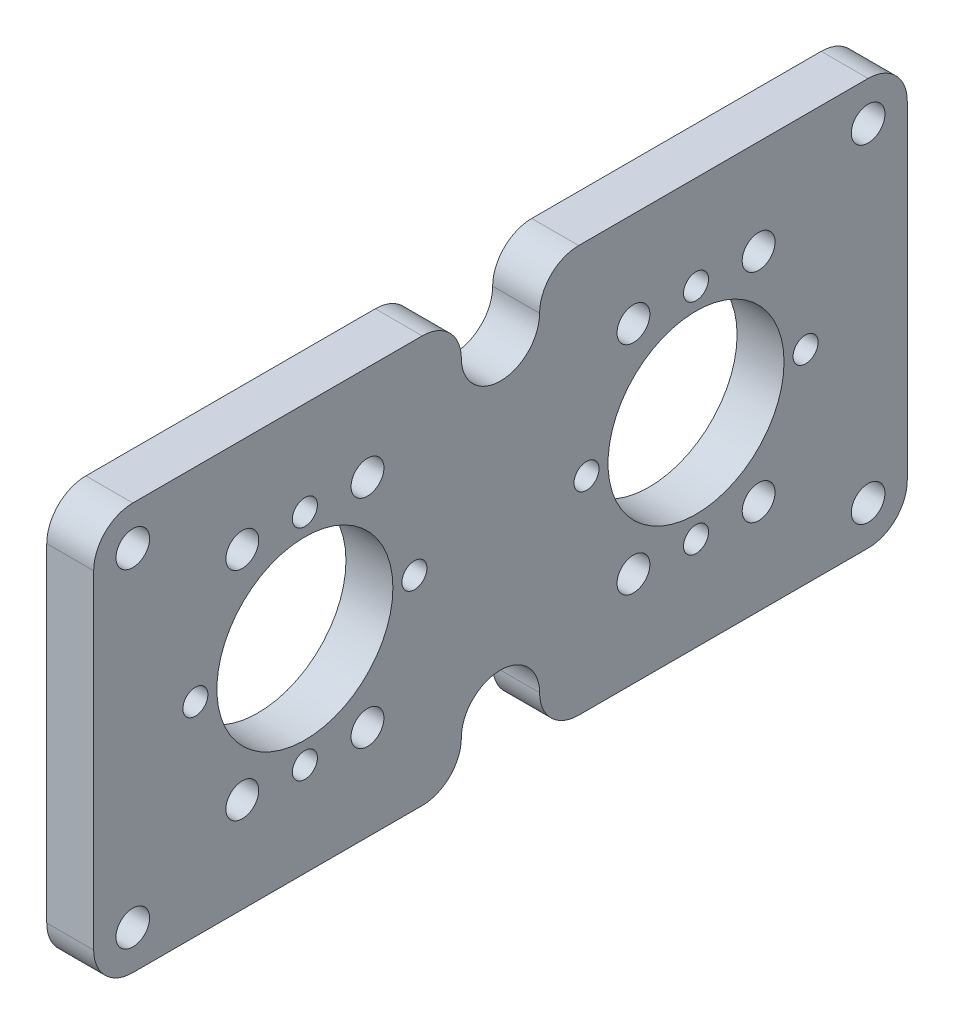
from build123d import *

# Parameters (mm, degrees)
SKETCH_1_W          = 104
SKETCH_1_H          = 52
SKETCH_1_R          = 11.25
EXTRUDE_1_DEPTH     = 6
SKETCH_2_R          = 2.15
SKETCH_2_R_2        = 5
CUT_EXTRUDE_1_DEPTH = 10
FILLET_2_R          = 5
SKETCH_3_R          = 1.6
SKETCH_3_R_2        = 2.1
CUT_EXTRUDE_2_DEPTH = 10
SKETCH1_R           = 4
CUT_EXTRUDE1_DEPTH  = 2


with BuildPart() as part:
    # 草图1 → 凸台-拉伸1 (new body)
    with BuildSketch(Plane(origin=(0, 0, 0), x_dir=(0, 0, -1), z_dir=(1, 0, 0))):
        with Locations((245.135135135, 41.033128111)):
            Rectangle(SKETCH_1_W, SKETCH_1_H)
        with Locations((220.135135135, 41.033128111)):
            Circle(SKETCH_1_R, mode=Mode.SUBTRACT)
        with Locations((270.135135135, 41.033128111)):
            Circle(SKETCH_1_R, mode=Mode.SUBTRACT)
    extrude(amount=EXTRUDE_1_DEPTH)

    # 草图2 → 切除-拉伸1 (cut)
    # profile 1 of 12: a face of its own
    with BuildSketch(Plane(origin=(6, 0, 0), x_dir=(0, 0, -1), z_dir=(1, 0, 0))):
        with Locations((198.135135135, 62.033128111)):
            Circle(SKETCH_2_R)
    # profile 2 of 12: a face of its own
    with BuildSketch(Plane(origin=(6, 0, 0), x_dir=(0, 0, -1), z_dir=(1, 0, 0))):
        with Locations((198.135135135, 20.033128111)):
            Circle(SKETCH_2_R)
    # profile 3 of 12: a face of its own
    with BuildSketch(Plane(origin=(6, 0, 0), x_dir=(0, 0, -1), z_dir=(1, 0, 0))):
        with Locations((245.135135135, 20.033128111)):
            Circle(SKETCH_2_R_2)
        with Locations((245.135135135, 20.033128111)):
            Circle(SKETCH_2_R, mode=Mode.SUBTRACT)
    # profile 4 of 12: a face of its own
    with BuildSketch(Plane(origin=(6, 0, 0), x_dir=(0, 0, -1), z_dir=(1, 0, 0))):
        with BuildLine():
            Line((245.13513516, 15.033128111), (250.135135135, 15.033128111))
            Line((250.135135135, 15.033128111), (250.135135135, 20.033128111))
            ThreePointArc((250.135135135, 20.033128111), (248.67066905, 16.497594214), (245.13513516, 15.033128111))
        make_face()
    # profile 5 of 12: a face of its own
    with BuildSketch(Plane(origin=(6, 0, 0), x_dir=(0, 0, -1), z_dir=(1, 0, 0))):
        with BuildLine():
            Line((240.135135135, 15.033128111), (245.13513516, 15.033128111))
            ThreePointArc((245.13513516, 15.033128111), (241.599601238, 16.497594196), (240.135135135, 20.033128111))
            Line((240.135135135, 20.033128111), (240.135135135, 15.033128111))
        make_face()
    # profile 6 of 12: a face of its own
    with BuildSketch(Plane(origin=(6, 0, 0), x_dir=(0, 0, -1), z_dir=(1, 0, 0))):
        with Locations((245.135135135, 20.033128111)):
            Circle(SKETCH_2_R)
    # profile 7 of 12: a face of its own
    with BuildSketch(Plane(origin=(6, 0, 0), x_dir=(0, 0, -1), z_dir=(1, 0, 0))):
        with Locations((245.135135135, 62.033128111)):
            Circle(SKETCH_2_R_2)
        with Locations((245.135135135, 62.033128111)):
            Circle(SKETCH_2_R, mode=Mode.SUBTRACT)
    # profile 8 of 12: a face of its own
    with BuildSketch(Plane(origin=(6, 0, 0), x_dir=(0, 0, -1), z_dir=(1, 0, 0))):
        with Locations((245.135135135, 62.033128111)):
            Circle(SKETCH_2_R)
    # profile 9 of 12: a face of its own
    with BuildSketch(Plane(origin=(6, 0, 0), x_dir=(0, 0, -1), z_dir=(1, 0, 0))):
        with BuildLine():
            ThreePointArc((245.135135095, 67.033128111), (248.670669027, 65.568662031), (250.135135135, 62.033128111))
            Line((250.135135135, 62.033128111), (250.135135135, 67.033128111))
            Line((250.135135135, 67.033128111), (245.135135095, 67.033128111))
        make_face()
    # profile 10 of 12: a face of its own
    with BuildSketch(Plane(origin=(6, 0, 0), x_dir=(0, 0, -1), z_dir=(1, 0, 0))):
        with BuildLine():
            Line((240.135135135, 67.033128111), (240.135135135, 62.033128111))
            ThreePointArc((240.135135135, 62.033128111), (241.599601215, 65.568662003), (245.135135095, 67.033128111))
            Line((245.135135095, 67.033128111), (240.135135135, 67.033128111))
        make_face()
    # profile 11 of 12: a face of its own
    with BuildSketch(Plane(origin=(6, 0, 0), x_dir=(0, 0, -1), z_dir=(1, 0, 0))):
        with Locations((292.135135135, 62.033128111)):
            Circle(SKETCH_2_R)
    # profile 12 of 12: a face of its own
    with BuildSketch(Plane(origin=(6, 0, 0), x_dir=(0, 0, -1), z_dir=(1, 0, 0))):
        with Locations((292.135135135, 20.033128111)):
            Circle(SKETCH_2_R)
    extrude(amount=-CUT_EXTRUDE_1_DEPTH, mode=Mode.SUBTRACT)

    # 圆角2
    fillet_2_edges = [part.edges().sort_by_distance(p)[0] for p in [
        (3, 15.033128111, -240.135135135),
        (3, 15.033128111, -193.135135135),
        (3, 67.033128111, -240.135135135),
        (3, 67.033128111, -250.135135135),
        (3, 67.033128111, -297.135135135),
        (3, 15.033128111, -297.135135135),
        (3, 15.033128111, -250.135135135),
        (3, 67.033128111, -193.135135135),
    ]]
    fillet(fillet_2_edges, radius=FILLET_2_R - 0.0001)  # a hair under: the kernel refuses the full size

    # 草图3 → 切除-拉伸2 (cut)
    with BuildSketch(Plane(origin=(6, 0, 0), x_dir=(0, 0, -1), z_dir=(1, 0, 0))):
        with Locations((220.135135135, 55.033128111)):
            Circle(SKETCH_3_R)
        with Locations((228.135135135, 54.889534571)):
            Circle(SKETCH_3_R_2)
        with Locations((228.135135135, 27.17672165)):
            Circle(SKETCH_3_R_2)
        with Locations((212.135135135, 27.17672165)):
            Circle(SKETCH_3_R_2)
        with Locations((212.135135135, 54.889534571)):
            Circle(SKETCH_3_R_2)
        with Locations((234.135135135, 41.033128111)):
            Circle(SKETCH_3_R)
        with Locations((220.135135135, 27.033128111)):
            Circle(SKETCH_3_R)
        with Locations((206.135135135, 41.033128111)):
            Circle(SKETCH_3_R)
        with Locations((284.135135135, 41.033128111)):
            Circle(SKETCH_3_R)
        with Locations((270.135135135, 27.033128111)):
            Circle(SKETCH_3_R)
        with Locations((256.135135135, 41.033128111)):
            Circle(SKETCH_3_R)
        with Locations((278.135135135, 54.889534571)):
            Circle(SKETCH_3_R_2)
        with Locations((278.135135135, 27.17672165)):
            Circle(SKETCH_3_R_2)
        with Locations((262.135135135, 27.17672165)):
            Circle(SKETCH_3_R_2)
        with Locations((262.135135135, 54.889534571)):
            Circle(SKETCH_3_R_2)
        with Locations((270.135135135, 55.033128111)):
            Circle(SKETCH_3_R)
    extrude(amount=-CUT_EXTRUDE_2_DEPTH, mode=Mode.SUBTRACT)

    # Sketch1 → Cut-Extrude1 (cut)
    with BuildSketch(Plane.ZY):
        with Locations((-278.135135135, 27.17672165)):
            Circle(SKETCH1_R)
        with Locations((-278.135135135, 54.889534571)):
            Circle(SKETCH1_R)
        with Locations((-262.135135135, 54.889534571)):
            Circle(SKETCH1_R)
        with Locations((-262.135135135, 27.17672165)):
            Circle(SKETCH1_R)
        with Locations((-228.135135135, 54.889534571)):
            Circle(SKETCH1_R)
        with Locations((-212.135135135, 54.889534571)):
            Circle(SKETCH1_R)
        with Locations((-212.135135135, 27.17672165)):
            Circle(SKETCH1_R)
        with Locations((-228.135135135, 27.17672165)):
            Circle(SKETCH1_R)
    extrude(amount=-CUT_EXTRUDE1_DEPTH, mode=Mode.SUBTRACT)


solid = part.part
